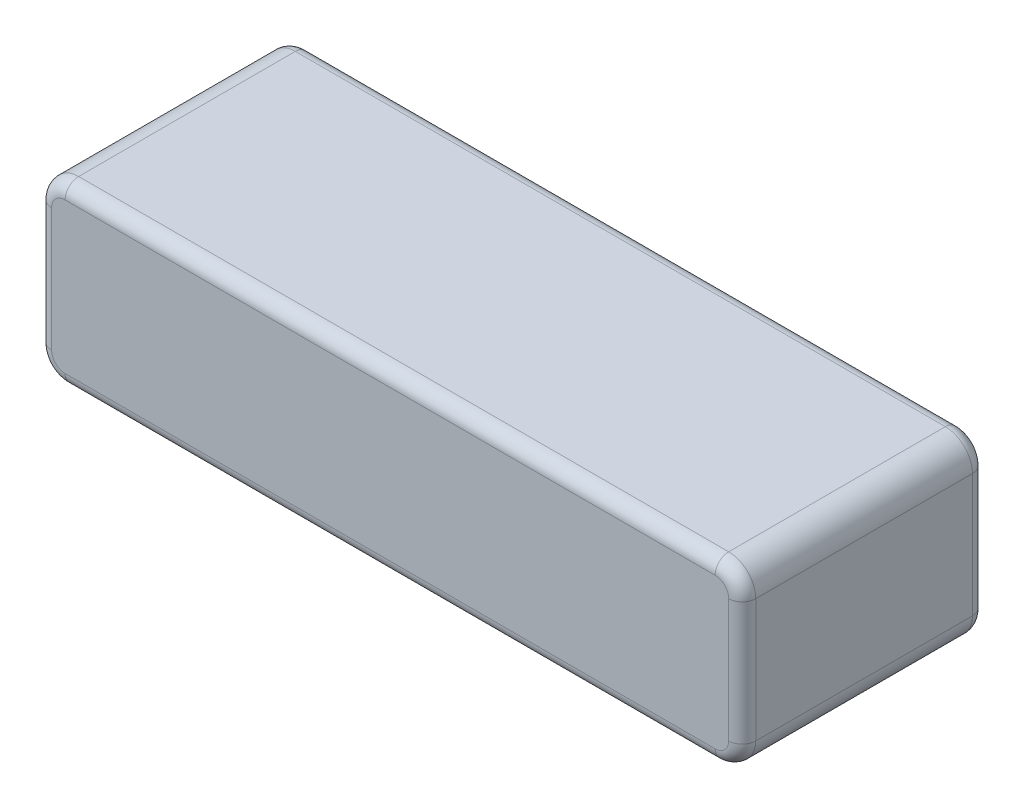
from build123d import *

# Parameters (mm, degrees)
SKETCH1_W           = 52
SKETCH1_H           = 18
BOSS_EXTRUDE1_DEPTH = 13.1
FILLET1_R           = 2
FILLET2_R           = 1


with BuildPart() as part:
    # Sketch1 → Boss-Extrude1 (new body)
    with BuildSketch(Plane(origin=(0, 0, 0), x_dir=(1, 0, 0), z_dir=(0, 1, 0))):
        Rectangle(SKETCH1_W, SKETCH1_H)
    extrude(amount=BOSS_EXTRUDE1_DEPTH)

    # Fillet1
    fillet1_edges = [part.edges().sort_by_distance(p)[0] for p in [
        (-26, 0, 0),
        (-26, 13.1, 0),
        (26, 0, 0),
        (26, 13.1, 0),
    ]]
    fillet(fillet1_edges, radius=FILLET1_R)

    # Fillet2
    fillet2_edges = [part.edges().sort_by_distance(p)[0] for p in [
        (-25.414213562, 12.514213562, 9),
        (-26, 6.55, 9),
        (-25.414213562, 0.585786438, 9),
        (0, 0, 9),
        (25.414213562, 0.585786438, 9),
        (26, 6.55, 9),
        (25.414213562, 12.514213562, 9),
        (25.414213562, 12.514213562, -9),
        (26, 6.55, -9),
        (25.414213562, 0.585786438, -9),
        (0, 0, -9),
        (-25.414213562, 0.585786438, -9),
        (-26, 6.55, -9),
        (-25.414213562, 12.514213562, -9),
        (0, 13.1, 9),
        (0, 13.1, -9),
    ]]
    fillet(fillet2_edges, radius=FILLET2_R)


solid = part.part
